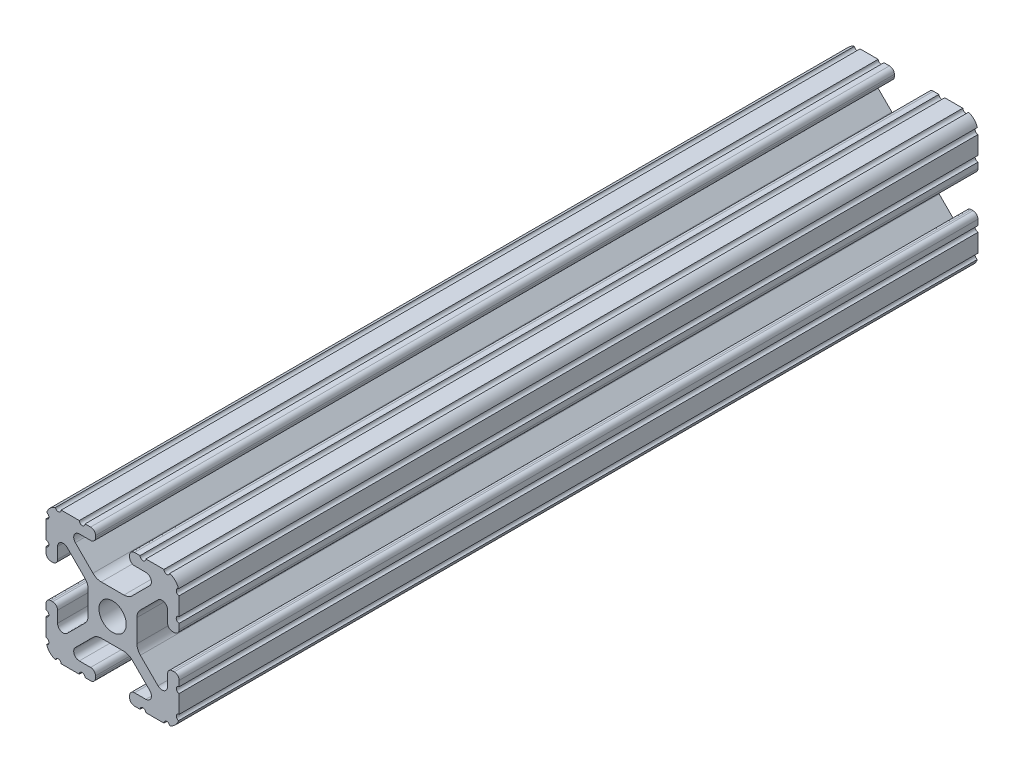
from build123d import *

# Parameters (mm, degrees)
BOSS_EXTRUDE1_DEPTH     = 76.2
CUT_EXTRUDE1_DEPTH      = 79.288057838
CUT_EXTRUDE1_DEPTH_BACK = 79.288057838
SKETCH5_R               = 0.55245
CUT_EXTRUDE2_DEPTH      = 79.288057838
CUT_EXTRUDE2_DEPTH_BACK = 79.288057838
SKETCH6_R               = 3.175


with BuildPart() as part:
    # Sketch4 → Boss-Extrude1 (new, symmetric)
    with BuildSketch(Plane.XY):
        with BuildLine():
            Line((4.190365, -12.7), (10.11729625, -12.7))
            ThreePointArc((10.11729625, -12.7), (11.943543585, -11.943543585), (12.7, -10.11729625))
            Line((12.7, -10.11729625), (12.7, -4.190365))
            ThreePointArc((12.7, -4.190365), (12.42492494, -3.52627506), (11.760835, -3.2512))
            Line((11.760835, -3.2512), (11.429365, -3.2512))
            ThreePointArc((11.429365, -3.2512), (10.76527506, -3.52627506), (10.4902, -4.190365))
            Line((10.4902, -4.190365), (10.4902, -6.348478019))
            ThreePointArc((10.4902, -6.348478019), (9.830707141, -7.335478831), (8.666460301, -7.103895736))
            Line((8.666460301, -7.103895736), (5.299899128, -3.737334563))
            ThreePointArc((5.299899128, -3.737334563), (4.817571085, -3.015479634), (4.6482, -2.16399369))
            Line((4.6482, -2.16399369), (4.6482, 0))
            Line((4.6482, 0), (2.6035, 0))
            ThreePointArc((2.6035, 0), (1.840952505, -1.840952505), (0, -2.6035))
            Line((0, -2.6035), (0, -4.6482))
            Line((0, -4.6482), (2.16399369, -4.6482))
            ThreePointArc((2.16399369, -4.6482), (3.015479634, -4.817571085), (3.737334563, -5.299899128))
            Line((3.737334563, -5.299899128), (7.103895736, -8.666460301))
            ThreePointArc((7.103895736, -8.666460301), (7.335478831, -9.830707141), (6.348478019, -10.4902))
            Line((6.348478019, -10.4902), (4.190365, -10.4902))
            ThreePointArc((4.190365, -10.4902), (3.52627506, -10.76527506), (3.2512, -11.429365))
            Line((3.2512, -11.429365), (3.2512, -11.760835))
            ThreePointArc((3.2512, -11.760835), (3.52627506, -12.42492494), (4.190365, -12.7))
        make_face()
    extrude(amount=BOSS_EXTRUDE1_DEPTH, both=True)

    # Sketch5 → Cut-Extrude1 (cut, two sides: drawn at the far end of the back side and taken through both)
    with BuildSketch(Plane.XY.offset(-CUT_EXTRUDE1_DEPTH_BACK)):
        with Locations((10.356153152, -12.7)):
            Circle(SKETCH5_R)
        with Locations((5.796028019, -12.7)):
            Circle(SKETCH5_R)
        with Locations((12.7, -10.356153152)):
            Circle(SKETCH5_R)
        with Locations((12.7, -5.796028019)):
            Circle(SKETCH5_R)
    extrude(amount=CUT_EXTRUDE1_DEPTH + CUT_EXTRUDE1_DEPTH_BACK, mode=Mode.SUBTRACT)

    # Mirror1: part across plane


with BuildPart() as part_1:
    add(part.part)
    add(part.part.mirror(Plane(origin=(0, 0, 0), x_dir=(0, 0, 1), z_dir=(1, 0, 0))))

    # Mirror2: part across plane


with BuildPart() as part_2:
    add(part_1.part)
    add(part_1.part.mirror(Plane.ZX))

    # Sketch6 → Cut-Extrude2 (cut, two sides: drawn at the far end of the back side and taken through both)
    with BuildSketch(Plane(origin=(0, 0, 0), x_dir=(1, 0, 0), z_dir=(0, 1, 0)).offset(-CUT_EXTRUDE2_DEPTH_BACK)):
        with Locations((0, -63.5)):
            Circle(SKETCH6_R)
        with Locations((0, 63.5)):
            Circle(SKETCH6_R)
    extrude(amount=CUT_EXTRUDE2_DEPTH + CUT_EXTRUDE2_DEPTH_BACK, mode=Mode.SUBTRACT)


solid = part_2.part
